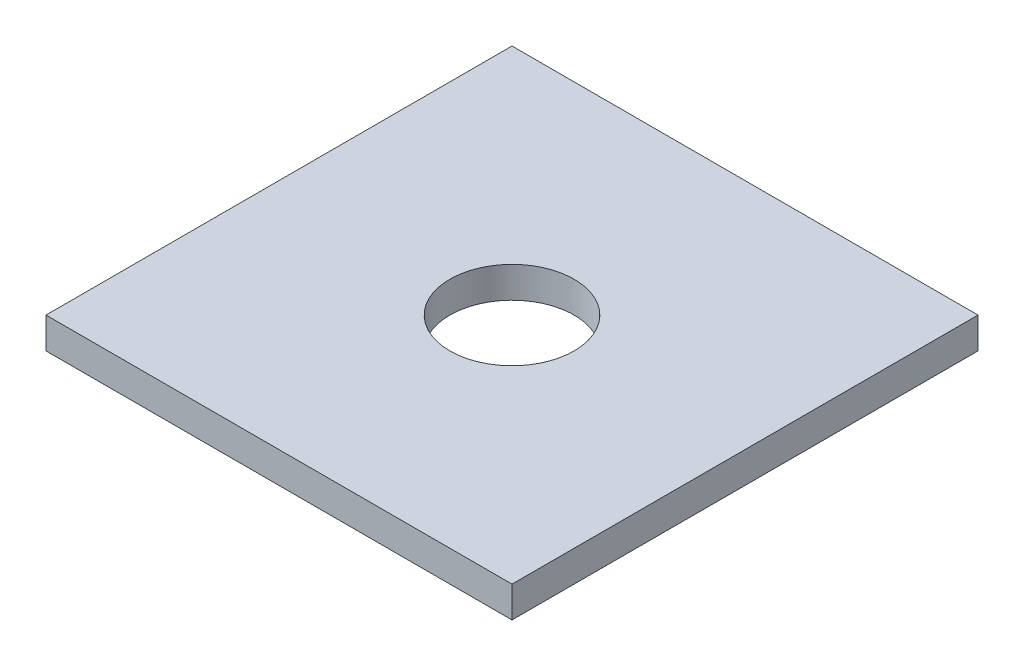
from build123d import *

# Parameters (mm, degrees)
SKETCH2_W           = 150
SKETCH2_H           = 150
SKETCH2_R           = 20
BOSS_EXTRUDE3_DEPTH = 10


with BuildPart() as part:
    # Sketch2 → Boss-Extrude3 (new body)
    with BuildSketch(Plane(origin=(0, 0, 0), x_dir=(1, 0, 0), z_dir=(0, 1, 0))):
        Rectangle(SKETCH2_W, SKETCH2_H)
        Circle(SKETCH2_R, mode=Mode.SUBTRACT)
    extrude(amount=BOSS_EXTRUDE3_DEPTH)


solid = part.part
